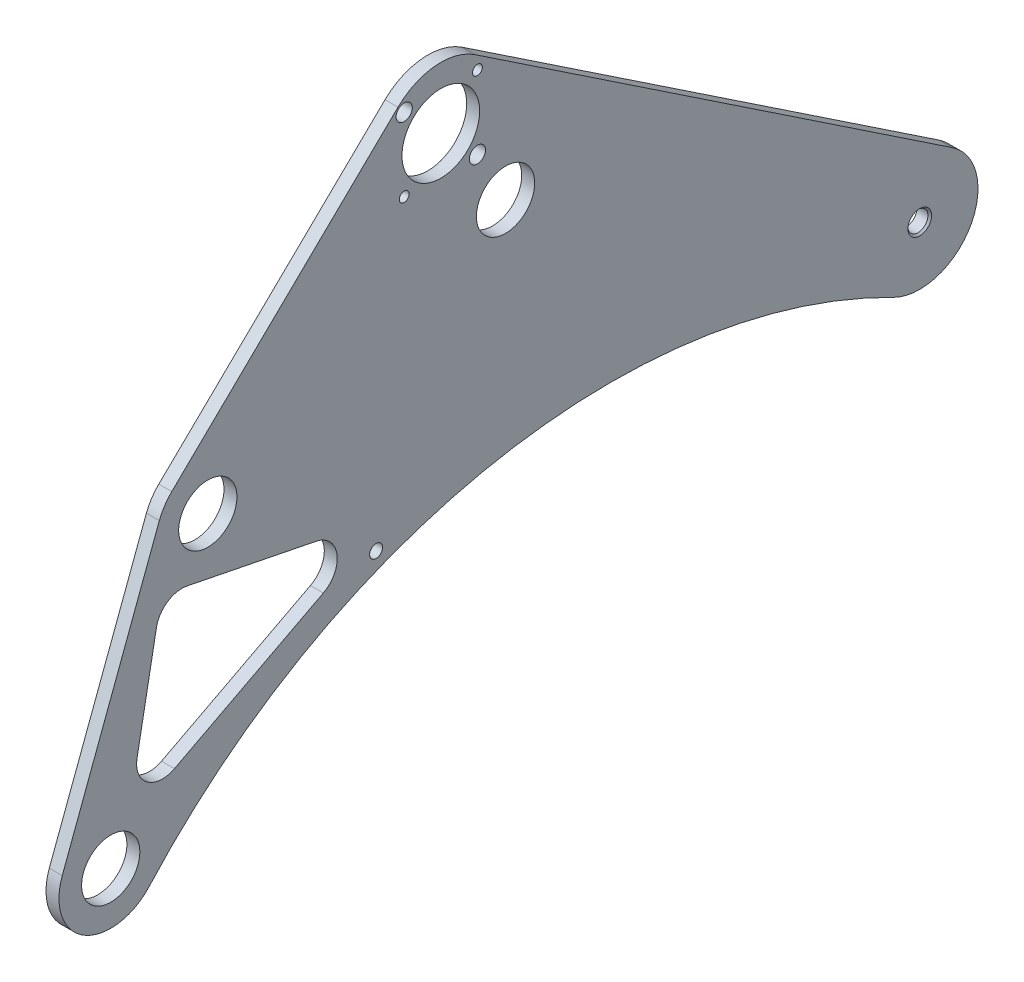
from build123d import *

# Parameters (mm, degrees)
BOSS_EXTRUDE1_DEPTH               = 6.35
CUT_EXTRUDE1_REACH                = 463.209
SKETCH3_R                         = 14.2875
SKETCH3_R_2                       = 19.05
SKETCH3_R_3                       = 2.413
SKETCH3_R_4                       = 3.96875
F_3_8_CLEARANCE_HOLE2_D           = 9.8044
F_3_8_CLEARANCE_HOLE2_CSINK_D     = 11.58748
F_3_8_CLEARANCE_HOLE2_CSINK_ANGLE = 90
F_1_4_0_2500_DOWEL_HOLE2_D        = 6.35
CUT_EXTRUDE2_DEPTH                = 462.208770751


with BuildPart() as part:
    # Sketch2 → Boss-Extrude1 (new body)
    with BuildSketch(Plane(origin=(0, 0, 0), x_dir=(0, 0, -1), z_dir=(1, 0, 0))):
        with BuildLine():
            Line((-420.65776111, -67.281464584), (-373.03276111, 59.718535416))
            ThreePointArc((-373.03276111, 59.718535416), (-370.505449055, 64.705606261), (-366.948304567, 69.018946606))
            Line((-366.948304567, 69.018946606), (-255.966736674, 176.828999095))
            ThreePointArc((-255.966736674, 176.828999095), (-237.683735505, 185.232360415), (-218.184119534, 180.26752505))
            Line((-218.184119534, 180.26752505), (15.883465704, 23.753865837))
            ThreePointArc((15.883465704, 23.753865837), (24.649476553, -14.454547059), (-12.975284095, -25.459234624))
            ThreePointArc((-12.975284095, -25.459234624), (-206.983757432, 2.660555148), (-377.990639572, -93.186492612))
            ThreePointArc((-377.990639572, -93.186492612), (-410.057040874, -97.911605155), (-420.65776111, -67.281464584))
        make_face()
    extrude(amount=BOSS_EXTRUDE1_DEPTH)

    # Sketch3 → Cut-Extrude1 (cut, up to next)
    with BuildSketch(Plane(origin=(6.35, 0, 0), x_dir=(0, 0, -1), z_dir=(1, 0, 0)), mode=Mode.PRIVATE) as cut_extrude1_sk1:
        with Locations((-203.2, 111.125)):
            Circle(SKETCH3_R)
    cut_extrude1_tool1 = extrude(cut_extrude1_sk1.sketch, amount=-CUT_EXTRUDE1_REACH, mode=Mode.PRIVATE) & part.part
    # Sketch3 → Cut-Extrude1 (cut, up to next)
    with BuildSketch(Plane(origin=(6.35, 0, 0), x_dir=(0, 0, -1), z_dir=(1, 0, 0)), mode=Mode.PRIVATE) as cut_extrude1_sk2:
        with Locations((-349.25, 50.8)):
            Circle(SKETCH3_R)
    cut_extrude1_tool2 = extrude(cut_extrude1_sk2.sketch, amount=-CUT_EXTRUDE1_REACH, mode=Mode.PRIVATE) & part.part
    # Sketch3 → Cut-Extrude1 (cut, up to next)
    with BuildSketch(Plane(origin=(6.35, 0, 0), x_dir=(0, 0, -1), z_dir=(1, 0, 0)), mode=Mode.PRIVATE) as cut_extrude1_sk3:
        with Locations((-396.875, -76.2)):
            Circle(SKETCH3_R)
    cut_extrude1_tool3 = extrude(cut_extrude1_sk3.sketch, amount=-CUT_EXTRUDE1_REACH, mode=Mode.PRIVATE) & part.part
    # Sketch3 → Cut-Extrude1 (cut, up to next)
    with BuildSketch(Plane(origin=(6.35, 0, 0), x_dir=(0, 0, -1), z_dir=(1, 0, 0)), mode=Mode.PRIVATE) as cut_extrude1_sk4:
        with Locations((-234.95, 155.194)):
            Circle(SKETCH3_R_2)
    cut_extrude1_tool4 = extrude(cut_extrude1_sk4.sketch, amount=-CUT_EXTRUDE1_REACH, mode=Mode.PRIVATE) & part.part
    # Sketch3 → Cut-Extrude1 (cut, up to next)
    with BuildSketch(Plane(origin=(6.35, 0, 0), x_dir=(0, 0, -1), z_dir=(1, 0, 0)), mode=Mode.PRIVATE) as cut_extrude1_sk5:
        with Locations((-252.910512242, 137.233487758)):
            Circle(SKETCH3_R_3)
    cut_extrude1_tool5 = extrude(cut_extrude1_sk5.sketch, amount=-CUT_EXTRUDE1_REACH, mode=Mode.PRIVATE) & part.part
    # Sketch3 → Cut-Extrude1 (cut, up to next)
    with BuildSketch(Plane(origin=(6.35, 0, 0), x_dir=(0, 0, -1), z_dir=(1, 0, 0)), mode=Mode.PRIVATE) as cut_extrude1_sk6:
        with Locations((-216.989487758, 137.233487758)):
            Circle(SKETCH3_R_4)
    cut_extrude1_tool6 = extrude(cut_extrude1_sk6.sketch, amount=-CUT_EXTRUDE1_REACH, mode=Mode.PRIVATE) & part.part
    # Sketch3 → Cut-Extrude1 (cut, up to next)
    with BuildSketch(Plane(origin=(6.35, 0, 0), x_dir=(0, 0, -1), z_dir=(1, 0, 0)), mode=Mode.PRIVATE) as cut_extrude1_sk7:
        with Locations((-216.989487758, 173.154512242)):
            Circle(SKETCH3_R_3)
    cut_extrude1_tool7 = extrude(cut_extrude1_sk7.sketch, amount=-CUT_EXTRUDE1_REACH, mode=Mode.PRIVATE) & part.part
    # Sketch3 → Cut-Extrude1 (cut, up to next)
    with BuildSketch(Plane(origin=(6.35, 0, 0), x_dir=(0, 0, -1), z_dir=(1, 0, 0)), mode=Mode.PRIVATE) as cut_extrude1_sk8:
        with Locations((-252.910512242, 173.154512242)):
            Circle(SKETCH3_R_4)
    cut_extrude1_tool8 = extrude(cut_extrude1_sk8.sketch, amount=-CUT_EXTRUDE1_REACH, mode=Mode.PRIVATE) & part.part
    add(cut_extrude1_tool1.solids().sort_by_distance((6.35, 111.125, 203.2))[0], mode=Mode.SUBTRACT)
    add(cut_extrude1_tool2.solids().sort_by_distance((6.35, 50.8, 349.25))[0], mode=Mode.SUBTRACT)
    add(cut_extrude1_tool3.solids().sort_by_distance((6.35, -76.2, 396.875))[0], mode=Mode.SUBTRACT)
    add(cut_extrude1_tool4.solids().sort_by_distance((6.35, 155.194, 234.95))[0], mode=Mode.SUBTRACT)
    add(cut_extrude1_tool5.solids().sort_by_distance((6.35, 137.233488, 252.910512))[0], mode=Mode.SUBTRACT)
    add(cut_extrude1_tool6.solids().sort_by_distance((6.35, 137.233488, 216.989488))[0], mode=Mode.SUBTRACT)
    add(cut_extrude1_tool7.solids().sort_by_distance((6.35, 173.154512, 216.989488))[0], mode=Mode.SUBTRACT)
    add(cut_extrude1_tool8.solids().sort_by_distance((6.35, 173.154512, 252.910512))[0], mode=Mode.SUBTRACT)

    # 3/8 Clearance Hole2 (through all)
    with Locations(Plane(origin=(6.35, 0, 0), x_dir=(0, 0, -1), z_dir=(1, 0, 0))):
        with Locations((0, 0)):
            CounterSinkHole(F_3_8_CLEARANCE_HOLE2_D / 2, F_3_8_CLEARANCE_HOLE2_CSINK_D / 2, counter_sink_angle=F_3_8_CLEARANCE_HOLE2_CSINK_ANGLE)

    # 1/4 (0.2500) Dowel Hole2 (through all)
    with Locations(Plane(origin=(6.35, 0, 0), x_dir=(0, 0, -1), z_dir=(1, 0, 0))):
        with Locations((-266.7, -6.35)):
            Hole(F_1_4_0_2500_DOWEL_HOLE2_D / 2)

    # Sketch14 → Cut-Extrude2 (cut, through all)
    with BuildSketch(Plane(origin=(6.35, 0, 0), x_dir=(0, 0, -1), z_dir=(1, 0, 0))):
        with BuildLine():
            Line((-365.600411715, -49.359627546), (-292.575411715, -11.259627546))
            ThreePointArc((-292.575411715, -11.259627546), (-285.877370021, 1.794150333), (-295.959325084, 12.453374581))
            Line((-295.959325084, 12.453374581), (-359.459325084, 25.153374581))
            ThreePointArc((-359.459325084, 25.153374581), (-369.058218075, 23.224411423), (-374.432476774, 15.040464395))
            Line((-374.432476774, 15.040464395), (-383.957476774, -35.759535605))
            ThreePointArc((-383.957476774, -35.759535605), (-379.035203223, -48.304573838), (-365.600411715, -49.359627546))
        make_face()
    extrude(amount=-CUT_EXTRUDE2_DEPTH, mode=Mode.SUBTRACT)


solid = part.part
